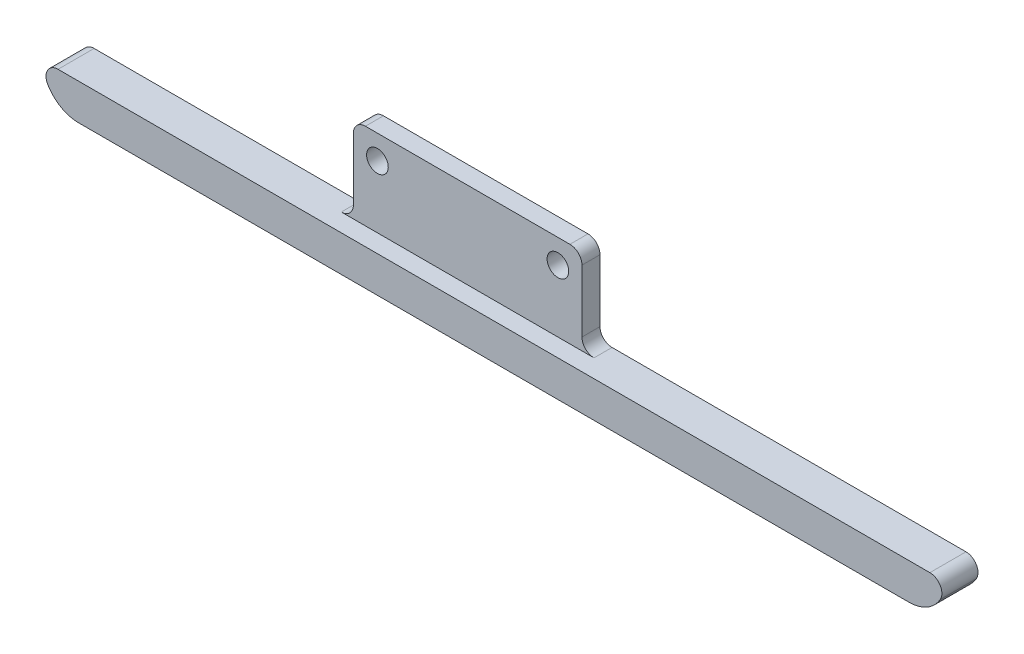
from build123d import *

# Parameters (mm, degrees)
SKETCH1_W            = 150
SKETCH1_H            = 6
BOSS_EXTRUDE1_DEPTH  = 6
SKETCH1_3_W          = 38
SKETCH1_3_H          = 14.35
BOSS_EXTRUDE2_DEPTH  = 3
M3_CLEARANCE_HOLE1_D = 3.6
FILLET1_R            = 6
FILLET2_R            = 2


with BuildPart() as part:
    # Sketch1 → Boss-Extrude1 (new body)
    with BuildSketch(Plane.XY):
        with Locations((75, 3)):
            Rectangle(SKETCH1_W, SKETCH1_H)
    extrude(amount=BOSS_EXTRUDE1_DEPTH)

    # Sketch1<3> → Boss-Extrude2 (add)
    with BuildSketch(Plane.XY):
        with Locations((67.63, 13.175)):
            Rectangle(SKETCH1_3_W, SKETCH1_3_H)
    extrude(amount=BOSS_EXTRUDE2_DEPTH)

    # M3 Clearance Hole1 (through all)
    with Locations(Plane.XY.offset(3)):
        with Locations((52.63, 16.35), (82.63, 16.35)):
            Hole(M3_CLEARANCE_HOLE1_D / 2)

    # Fillet1
    fillet1_edges = [part.edges().sort_by_distance(p)[0] for p in [
        (150, 0, 3),
        (0, 0, 3),
    ]]
    fillet(fillet1_edges, radius=FILLET1_R - 0.0001)  # a hair under: the kernel refuses the full size

    # Fillet2
    fillet2_edges = [part.edges().sort_by_distance(p)[0] for p in [
        (86.63, 6, 1.5),
        (86.63, 20.35, 1.5),
        (48.63, 20.35, 1.5),
        (48.63, 6, 1.5),
        (0, 6, 3),
        (150, 6, 3),
    ]]
    fillet(fillet2_edges, radius=FILLET2_R)


solid = part.part
